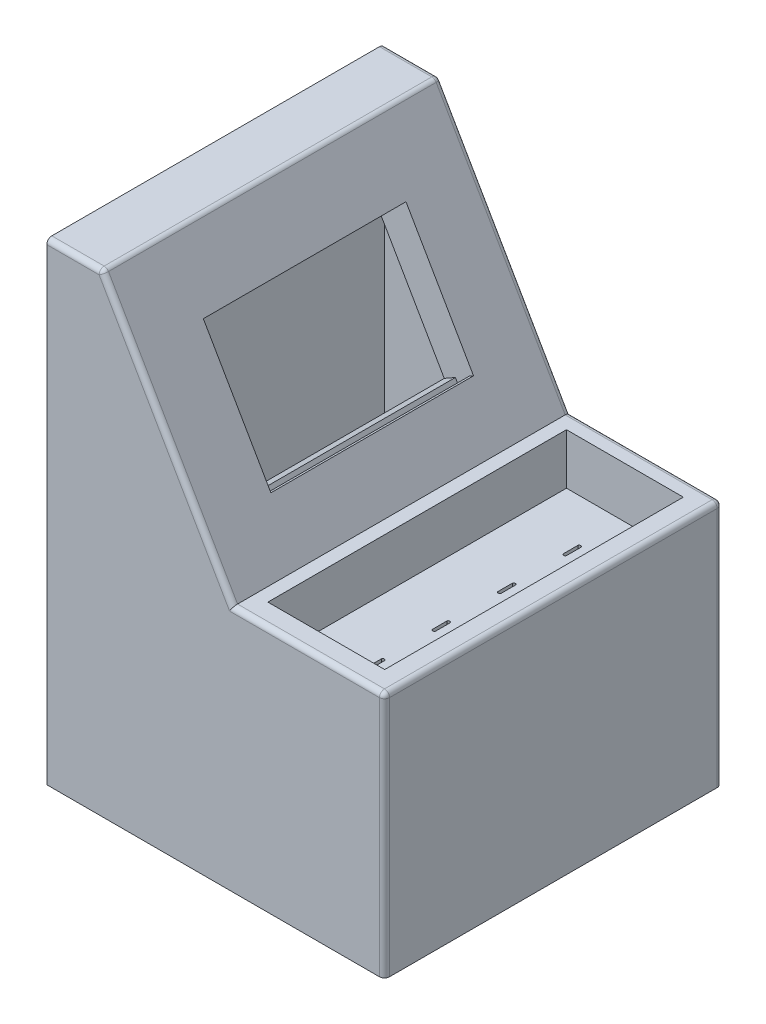
from build123d import *

# Parameters (mm, degrees)
BOSS_EXTRUDE1_DEPTH            = 508
SKETCH2_W                      = 175.72130466
SKETCH2_H                      = 449.160798253
CUT_EXTRUDE1_DEPTH             = 76.2
SKETCH3_W                      = 304.8
SKETCH3_H                      = 203.2
CUT_EXTRUDE3_DEPTH             = 50.8
SHELL2_START                   = 27.94
SHELL2_DEPTH                   = 452.12
SHELL2_2_DEPTH                 = 45.72
SHELL2_START_2                 = 434.34
SHELL2_3_DEPTH                 = 45.72
FILLET1_R                      = 7.62
CUT_EXTRUDE4_REACH             = 965.862
CUT_EXTRUDE4_DIRECTION_2_DEPTH = 97.536
CUT_EXTRUDE5_REACH             = 832.247


# Read off the part's stored shape, not the designer's step: Shell2
with BuildPart() as part:
    # Sketch1 → Boss-Extrude1 (new body)
    with BuildSketch(Plane.XY):
        Polygon((508, 0), (508, 371.248348728), (279.4, 371.248348728), (83.128822626, 711.2), (0, 711.2), (0, 0), align=None)
    extrude(amount=BOSS_EXTRUDE1_DEPTH)

    # Sketch2 → Cut-Extrude1 (cut)
    with BuildSketch(Plane(origin=(0, 371.248348728, 0), x_dir=(1, 0, 0), z_dir=(0, 1, 0))):
        with Locations((387.505332687, -250.48614125)):
            Rectangle(SKETCH2_W, SKETCH2_H)
    extrude(amount=-CUT_EXTRUDE1_DEPTH, mode=Mode.SUBTRACT)

    # Sketch3 → Cut-Extrude3 (cut)
    with BuildSketch(Plane(origin=(370.305250556, 213.795836091, 0), x_dir=(0, 0, -1), z_dir=(0.8660254037844397, 0.49999999999999806, 0))):
        with Locations((-254, 371.152855858)):
            Rectangle(SKETCH3_W, SKETCH3_H)
    extrude(amount=-CUT_EXTRUDE3_DEPTH, mode=Mode.SUBTRACT)

    # Shell2 outline → Shell2 (cut)
    with BuildSketch(Plane.XY.offset(SHELL2_START)):
        Polygon((27.94, 27.94), (480.06, 27.94), (480.06, 267.108348728), (271.704680357, 267.108348728), (271.704680357, 343.308348728), (263.268833479, 343.308348728), (225.302072845, 409.068707145), (205.504732114, 397.638707145), (191.534732114, 421.835456927), (89.934732114, 597.811818976), (75.964732114, 622.008568757), (95.762072845, 633.438568757), (66.997656105, 683.26), (27.94, 683.26), align=None)
    extrude(amount=SHELL2_DEPTH, mode=Mode.SUBTRACT)

    # Shell2 2 outline → Shell2 2 (cut)
    with BuildSketch(Plane.XY.offset(SHELL2_START)):
        Polygon((225.302072845, 409.068707145), (95.762072845, 633.438568757), (75.964732114, 622.008568757), (89.934732114, 597.811818976), (191.534732114, 421.835456927), (205.504732114, 397.638707145), align=None)
    extrude(amount=SHELL2_2_DEPTH, mode=Mode.SUBTRACT)

    # Shell2 3 outline → Shell2 3 (cut)
    with BuildSketch(Plane.XY.offset(SHELL2_START_2)):
        Polygon((225.302072845, 409.068707145), (95.762072845, 633.438568757), (75.964732114, 622.008568757), (89.934732114, 597.811818976), (191.534732114, 421.835456927), (205.504732114, 397.638707145), align=None)
    extrude(amount=SHELL2_3_DEPTH, mode=Mode.SUBTRACT)

    # Fillet1
    fillet1_edges = [part.edges().sort_by_distance(p)[0] for p in [
        (508, 185.624174364, 0),
        (393.7, 371.248348728, 508),
        (83.128822626, 711.2, 254),
        (508, 371.248348728, 254),
        (181.264411313, 541.224174364, 508),
        (41.564411313, 711.2, 508),
        (508, 185.624174364, 508),
        (41.564411313, 711.2, 0),
        (181.264411313, 541.224174364, 0),
        (393.7, 371.248348728, 0),
    ]]
    fillet(fillet1_edges, radius=FILLET1_R)

    # Cut-Extrude4: up to this face of the body (flat: up to its plane)
    cut_extrude4_end = Plane(part.part.faces().sort_by_distance((162.73177737, 522.523637951, 101.6))[0])
    # Sketch6 → Cut-Extrude4 (cut, up to the picked face)
    with BuildSketch(Plane(origin=(0, 0, 406.4), x_dir=(-1, 0, 0), z_dir=(0, 0, -1)), mode=Mode.PRIVATE) as cut_extrude4_sk1:
        Polygon((-109.711824261, 652.442307464), (-240.02087993, 424.214985446), (-218.44952186, 411.898566558), (-97.827125151, 645.656599669), align=None)
    cut_extrude4_tool1 = split(extrude(cut_extrude4_sk1.sketch, amount=CUT_EXTRUDE4_REACH, mode=Mode.PRIVATE), bisect_by=cut_extrude4_end, keep=Keep.BOTH, mode=Mode.PRIVATE)
    add(cut_extrude4_tool1.solids().sort_by(Axis((172.556766, 522.406417, 406.4), (0, 0, -1)))[0], mode=Mode.SUBTRACT)

    # Sketch6 → Cut-Extrude4 direction 2 (cut)
    with BuildSketch(Plane(origin=(0, 0, 406.4), x_dir=(-1, 0, 0), z_dir=(0, 0, -1))):
        Polygon((-109.711824261, 652.442307464), (-240.02087993, 424.214985446), (-218.44952186, 411.898566558), (-97.827125151, 645.656599669), align=None)
    extrude(amount=-CUT_EXTRUDE4_DIRECTION_2_DEPTH, mode=Mode.SUBTRACT)

    # Sketch10 → Cut-Extrude5 (cut, up to next)
    with BuildSketch(Plane(origin=(0, 295.048348728, 0), x_dir=(1, 0, 0), z_dir=(0, 1, 0)), mode=Mode.PRIVATE) as cut_extrude5_sk1:
        with BuildLine():
            Line((384.681985017, -385.451435914), (385.481985017, -385.451435914))
            ThreePointArc((385.481985017, -385.451435914), (386.896198579, -386.037222352), (387.481985017, -387.451435914))
            Line((387.481985017, -387.451435914), (387.481985017, -408.951435914))
            ThreePointArc((387.481985017, -408.951435914), (386.896198579, -410.365649476), (385.481985017, -410.951435914))
            Line((385.481985017, -410.951435914), (384.681985017, -410.951435914))
            ThreePointArc((384.681985017, -410.951435914), (383.267771454, -410.365649476), (382.681985017, -408.951435914))
            Line((382.681985017, -408.951435914), (382.681985017, -387.451435914))
            ThreePointArc((382.681985017, -387.451435914), (383.267771454, -386.037222352), (384.681985017, -385.451435914))
        make_face()
    cut_extrude5_tool1 = extrude(cut_extrude5_sk1.sketch, amount=-CUT_EXTRUDE5_REACH, mode=Mode.PRIVATE) & part.part
    # Sketch10 → Cut-Extrude5 (cut, up to next)
    with BuildSketch(Plane(origin=(0, 295.048348728, 0), x_dir=(1, 0, 0), z_dir=(0, 1, 0)), mode=Mode.PRIVATE) as cut_extrude5_sk2:
        with BuildLine():
            Line((385.481985017, -312.438871317), (384.681985017, -312.438871317))
            ThreePointArc((384.681985017, -312.438871317), (383.267771454, -311.853084879), (382.681985017, -310.438871317))
            Line((382.681985017, -310.438871317), (382.681985017, -288.938871317))
            ThreePointArc((382.681985017, -288.938871317), (383.267771454, -287.524657755), (384.681985017, -286.938871317))
            Line((384.681985017, -286.938871317), (385.481985017, -286.938871317))
            ThreePointArc((385.481985017, -286.938871317), (386.896198579, -287.524657755), (387.481985017, -288.938871317))
            Line((387.481985017, -288.938871317), (387.481985017, -310.438871317))
            ThreePointArc((387.481985017, -310.438871317), (386.896198579, -311.853084879), (385.481985017, -312.438871317))
        make_face()
    cut_extrude5_tool2 = extrude(cut_extrude5_sk2.sketch, amount=-CUT_EXTRUDE5_REACH, mode=Mode.PRIVATE) & part.part
    # Sketch10 → Cut-Extrude5 (cut, up to next)
    with BuildSketch(Plane(origin=(0, 295.048348728, 0), x_dir=(1, 0, 0), z_dir=(0, 1, 0)), mode=Mode.PRIVATE) as cut_extrude5_sk3:
        with BuildLine():
            Line((385.481985017, -213.92630672), (384.681985017, -213.92630672))
            ThreePointArc((384.681985017, -213.92630672), (383.267771454, -213.340520282), (382.681985017, -211.92630672))
            Line((382.681985017, -211.92630672), (382.681985017, -190.42630672))
            ThreePointArc((382.681985017, -190.42630672), (383.267771454, -189.012093158), (384.681985017, -188.42630672))
            Line((384.681985017, -188.42630672), (385.481985017, -188.42630672))
            ThreePointArc((385.481985017, -188.42630672), (386.896198579, -189.012093158), (387.481985017, -190.42630672))
            Line((387.481985017, -190.42630672), (387.481985017, -211.92630672))
            ThreePointArc((387.481985017, -211.92630672), (386.896198579, -213.340520282), (385.481985017, -213.92630672))
        make_face()
    cut_extrude5_tool3 = extrude(cut_extrude5_sk3.sketch, amount=-CUT_EXTRUDE5_REACH, mode=Mode.PRIVATE) & part.part
    # Sketch10 → Cut-Extrude5 (cut, up to next)
    with BuildSketch(Plane(origin=(0, 295.048348728, 0), x_dir=(1, 0, 0), z_dir=(0, 1, 0)), mode=Mode.PRIVATE) as cut_extrude5_sk4:
        with BuildLine():
            Line((385.481985017, -115.413742123), (384.681985017, -115.413742123))
            ThreePointArc((384.681985017, -115.413742123), (383.267771454, -114.827955685), (382.681985017, -113.413742123))
            Line((382.681985017, -113.413742123), (382.681985017, -91.913742123))
            ThreePointArc((382.681985017, -91.913742123), (383.267771454, -90.499528561), (384.681985017, -89.913742123))
            Line((384.681985017, -89.913742123), (385.481985017, -89.913742123))
            ThreePointArc((385.481985017, -89.913742123), (386.896198579, -90.499528561), (387.481985017, -91.913742123))
            Line((387.481985017, -91.913742123), (387.481985017, -113.413742123))
            ThreePointArc((387.481985017, -113.413742123), (386.896198579, -114.827955685), (385.481985017, -115.413742123))
        make_face()
    cut_extrude5_tool4 = extrude(cut_extrude5_sk4.sketch, amount=-CUT_EXTRUDE5_REACH, mode=Mode.PRIVATE) & part.part
    add(cut_extrude5_tool1.solids().sort_by_distance((385.081985, 295.048349, 398.201436))[0], mode=Mode.SUBTRACT)
    add(cut_extrude5_tool2.solids().sort_by_distance((385.081985, 295.048349, 299.688871))[0], mode=Mode.SUBTRACT)
    add(cut_extrude5_tool3.solids().sort_by_distance((385.081985, 295.048349, 201.176307))[0], mode=Mode.SUBTRACT)
    add(cut_extrude5_tool4.solids().sort_by_distance((385.081985, 295.048349, 102.663742))[0], mode=Mode.SUBTRACT)


solid = part.part
